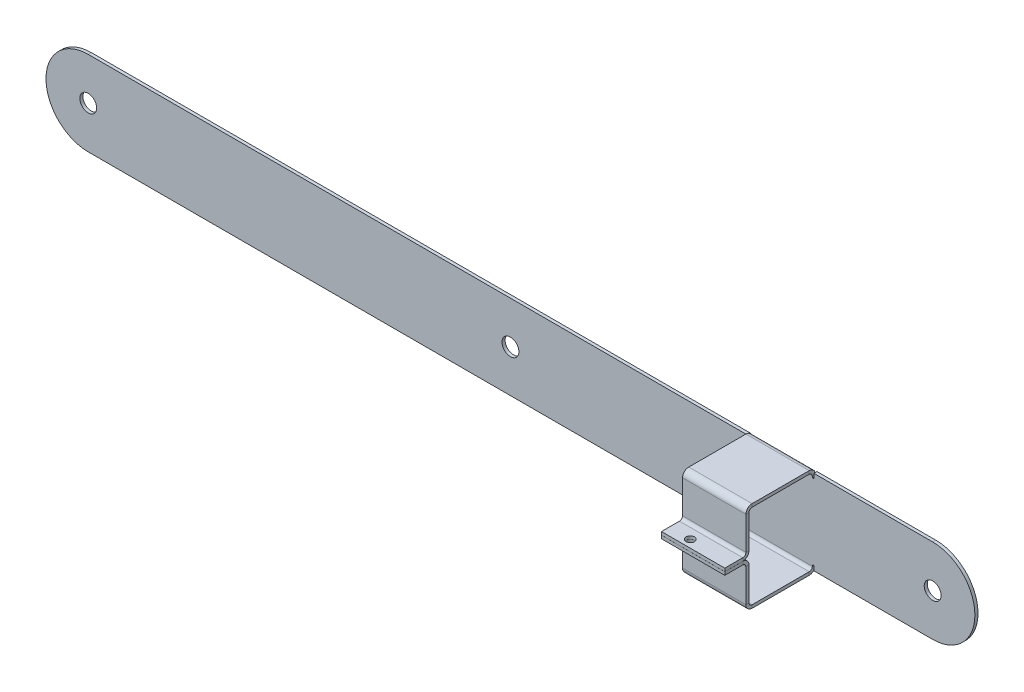
from build123d import *

# Parameters (mm, degrees)
SKETCH2_R                     = 2
BASE_FLANGE1_DEPTH            = 0.7366
EDGE_FLANGE1_STRIP_W          = 4.4196
EDGE_FLANGE1_STRIP_H          = 0.7366
EDGE_FLANGE1_STRIP_CUT_DEPTH  = 15
EDGE_FLANGE1_RELIEF_W         = 4.7879
EDGE_FLANGE1_RELIEF_H         = 0.3683
EDGE_FLANGE1_RELIEF_CUT_DEPTH = 0.7366
EDGE_FLANGE1_DEPTH            = 15
EDGE_FLANGE4_STRIP_W          = 4.4196
EDGE_FLANGE4_STRIP_H          = 0.7366
EDGE_FLANGE4_STRIP_CUT_DEPTH  = 15
EDGE_FLANGE4_RELIEF_W         = 4.7879
EDGE_FLANGE4_RELIEF_H         = 0.3683
EDGE_FLANGE4_RELIEF_CUT_DEPTH = 0.7366
EDGE_FLANGE4_DEPTH            = 15
EDGE_FLANGE5_STRIP_W          = 4.4196
EDGE_FLANGE5_STRIP_H          = 0.7366
EDGE_FLANGE5_STRIP_CUT_DEPTH  = 15
EDGE_FLANGE5_DEPTH            = 15
EDGE_FLANGE6_STRIP_W          = 4.4196
EDGE_FLANGE6_STRIP_H          = 0.7366
EDGE_FLANGE6_STRIP_CUT_DEPTH  = 15
EDGE_FLANGE6_DEPTH            = 15
EDGE_FLANGE7_START            = 56.5
EDGE_FLANGE7_DEPTH            = 15
EDGE_FLANGE7_2_DEPTH          = 15
EDGE_FLANGE8_START            = 56.5
EDGE_FLANGE8_DEPTH            = 15
EDGE_FLANGE8_2_DEPTH          = 15
F_2_0_2_DIAMETER_HOLE4_D      = 2


# Read off the part's stored shape, not the designer's step: Edge-Flange7, Edge-Flange8
# Sheet-metal steps are written as plain solids
with BuildPart() as part:
    # Sketch2 → Base-Flange1 (new body)
    with BuildSketch(Plane.XY):
        with BuildLine():
            Line((-100, 10), (100, 10))
            ThreePointArc((100, 10), (110, 0), (100, -10))
            Line((100, -10), (-100, -10))
            ThreePointArc((-100, -10), (-110, 0), (-100, 10))
        make_face()
        with Locations((100, 0)):
            Circle(SKETCH2_R, mode=Mode.SUBTRACT)
        Circle(SKETCH2_R, mode=Mode.SUBTRACT)
        with Locations((-100, 0)):
            Circle(SKETCH2_R, mode=Mode.SUBTRACT)
    extrude(amount=-BASE_FLANGE1_DEPTH)

    # Edge-Flange1 strip (across the edge) → Edge-Flange1 strip cut (cut)
    with BuildSketch(Plane(origin=(71.5, 10, 0), x_dir=(0, -1, 0), z_dir=(-1, 0, 0))):
        with Locations((-1.4732, -0.3683)):
            Rectangle(EDGE_FLANGE1_STRIP_W, EDGE_FLANGE1_STRIP_H)
    extrude(amount=EDGE_FLANGE1_STRIP_CUT_DEPTH, mode=Mode.SUBTRACT)

    # Edge-Flange1 relief (on the sheet) → Edge-Flange1 relief cut (cut)
    with BuildSketch(Plane(origin=(71.5, 9.2634, 0), x_dir=(0, -1, 0), z_dir=(0, 0, 1))):
        with Locations((-2.02565, 0.18415)):
            Rectangle(EDGE_FLANGE1_RELIEF_W, EDGE_FLANGE1_RELIEF_H)
        with Locations((-2.02565, -15.18415)):
            Rectangle(EDGE_FLANGE1_RELIEF_W, EDGE_FLANGE1_RELIEF_H)
    extrude(amount=-EDGE_FLANGE1_RELIEF_CUT_DEPTH, mode=Mode.SUBTRACT)

    # Edge-Flange1 section (across the edge) → Edge-Flange1 (add)
    with BuildSketch(Plane(origin=(71.5, 10, 0), x_dir=(0, -1, 0), z_dir=(-1, 0, 0))):
        with BuildLine():
            Line((-0.7366, 0.7366), (-0.7366, 15))
            Line((-0.7366, 15), (0, 15))
            Line((0, 15), (0, 0.7366))
            ThreePointArc((0, 0.7366), (0.215745145, 0.215745145), (0.7366, 0))
            Line((0.7366, 0), (0.7366, -0.7366))
            ThreePointArc((0.7366, -0.7366), (-0.30510971, -0.30510971), (-0.7366, 0.7366))
        make_face()
    extrude(amount=EDGE_FLANGE1_DEPTH)

    # Edge-Flange4 strip (across the edge) → Edge-Flange4 strip cut (cut)
    with BuildSketch(Plane(origin=(56.5, -10, 0), x_dir=(0, 1, 0), z_dir=(1, 0, 0))):
        with Locations((-1.4732, -0.3683)):
            Rectangle(EDGE_FLANGE4_STRIP_W, EDGE_FLANGE4_STRIP_H)
    extrude(amount=EDGE_FLANGE4_STRIP_CUT_DEPTH, mode=Mode.SUBTRACT)

    # Edge-Flange4 relief (on the sheet) → Edge-Flange4 relief cut (cut)
    with BuildSketch(Plane(origin=(56.5, -9.2634, 0), x_dir=(0, 1, 0), z_dir=(0, 0, 1))):
        with Locations((-2.02565, 0.18415)):
            Rectangle(EDGE_FLANGE4_RELIEF_W, EDGE_FLANGE4_RELIEF_H)
        with Locations((-2.02565, -15.18415)):
            Rectangle(EDGE_FLANGE4_RELIEF_W, EDGE_FLANGE4_RELIEF_H)
    extrude(amount=-EDGE_FLANGE4_RELIEF_CUT_DEPTH, mode=Mode.SUBTRACT)

    # Edge-Flange4 section (across the edge) → Edge-Flange4 (add)
    with BuildSketch(Plane(origin=(56.5, -10, 0), x_dir=(0, 1, 0), z_dir=(1, 0, 0))):
        with BuildLine():
            Line((-0.7366, 0.7366), (-0.7366, 15))
            Line((-0.7366, 15), (0, 15))
            Line((0, 15), (0, 0.7366))
            ThreePointArc((0, 0.7366), (0.215745145, 0.215745145), (0.7366, 0))
            Line((0.7366, 0), (0.7366, -0.7366))
            ThreePointArc((0.7366, -0.7366), (-0.30510971, -0.30510971), (-0.7366, 0.7366))
        make_face()
    extrude(amount=EDGE_FLANGE4_DEPTH)

    # Edge-Flange5 strip (across the edge) → Edge-Flange5 strip cut (cut)
    with BuildSketch(Plane(origin=(71.5, 10, 15), x_dir=(0, 0, -1), z_dir=(-1, 0, 0))):
        with Locations((-1.4732, -0.3683)):
            Rectangle(EDGE_FLANGE5_STRIP_W, EDGE_FLANGE5_STRIP_H)
    extrude(amount=EDGE_FLANGE5_STRIP_CUT_DEPTH, mode=Mode.SUBTRACT)

    # Edge-Flange5 section (across the edge) → Edge-Flange5 (add)
    with BuildSketch(Plane(origin=(71.5, 10, 15), x_dir=(0, 0, -1), z_dir=(-1, 0, 0))):
        with BuildLine():
            Line((-0.7366, 0.7366), (-0.7366, 9.99))
            Line((-0.7366, 9.99), (0, 9.99))
            Line((0, 9.99), (0, 0.7366))
            ThreePointArc((0, 0.7366), (0.215745145, 0.215745145), (0.7366, 0))
            Line((0.7366, 0), (0.7366, -0.7366))
            ThreePointArc((0.7366, -0.7366), (-0.30510971, -0.30510971), (-0.7366, 0.7366))
        make_face()
    extrude(amount=EDGE_FLANGE5_DEPTH)

    # Edge-Flange6 strip (across the edge) → Edge-Flange6 strip cut (cut)
    with BuildSketch(Plane(origin=(56.5, -10, 15), x_dir=(0, 0, -1), z_dir=(1, 0, 0))):
        with Locations((-1.4732, -0.3683)):
            Rectangle(EDGE_FLANGE6_STRIP_W, EDGE_FLANGE6_STRIP_H)
    extrude(amount=EDGE_FLANGE6_STRIP_CUT_DEPTH, mode=Mode.SUBTRACT)

    # Edge-Flange6 section (across the edge) → Edge-Flange6 (add)
    with BuildSketch(Plane(origin=(56.5, -10, 15), x_dir=(0, 0, -1), z_dir=(1, 0, 0))):
        with BuildLine():
            Line((-0.7366, 0.7366), (-0.7366, 10))
            Line((-0.7366, 10), (0, 10))
            Line((0, 10), (0, 0.7366))
            ThreePointArc((0, 0.7366), (0.215745145, 0.215745145), (0.7366, 0))
            Line((0.7366, 0), (0.7366, -0.7366))
            ThreePointArc((0.7366, -0.7366), (-0.30510971, -0.30510971), (-0.7366, 0.7366))
        make_face()
    extrude(amount=EDGE_FLANGE6_DEPTH)

    # Edge-Flange7 outline → Edge-Flange7 (cut)
    with BuildSketch(Plane.YZ.offset(EDGE_FLANGE7_START)):
        with BuildLine():
            Line((0, 15.7366), (-0.197371375, 15.7366))
            ThreePointArc((-0.197371375, 15.7366), (-0.7366, 15.197371375), (-1.4732, 15))
            Line((-1.4732, 15), (0, 15))
            Line((0, 15), (0, 15.7366))
        make_face()
    extrude(amount=EDGE_FLANGE7_DEPTH, mode=Mode.SUBTRACT)

    # Edge-Flange7 2 outline → Edge-Flange7 2 (add)
    with BuildSketch(Plane.YZ.offset(EDGE_FLANGE7_START)):
        with BuildLine():
            ThreePointArc((-0.197371375, 15.7366), (-0.050198073, 16.091907783), (0, 16.4732))
            Line((0, 16.4732), (0, 20.7366))
            Line((0, 20.7366), (-0.7366, 20.7366))
            Line((-0.7366, 20.7366), (-0.7366, 16.4732))
            ThreePointArc((-0.7366, 16.4732), (-0.952345145, 15.952345145), (-1.4732, 15.7366))
            Line((-1.4732, 15.7366), (-0.197371375, 15.7366))
        make_face()
    extrude(amount=EDGE_FLANGE7_2_DEPTH)

    # Edge-Flange8 outline → Edge-Flange8 (cut)
    with BuildSketch(Plane.YZ.offset(EDGE_FLANGE8_START)):
        with BuildLine():
            ThreePointArc((1.4832, 15), (0.7466, 15.197371375), (0.207371375, 15.7366))
            Line((0.207371375, 15.7366), (0.01, 15.7366))
            Line((0.01, 15.7366), (0.01, 15))
            Line((0.01, 15), (1.4832, 15))
        make_face()
    extrude(amount=EDGE_FLANGE8_DEPTH, mode=Mode.SUBTRACT)

    # Edge-Flange8 2 outline → Edge-Flange8 2 (add)
    with BuildSketch(Plane.YZ.offset(EDGE_FLANGE8_START)):
        with BuildLine():
            Line((0.7466, 20.7366), (0.01, 20.7366))
            Line((0.01, 20.7366), (0.01, 16.4732))
            ThreePointArc((0.01, 16.4732), (0.060198073, 16.091907783), (0.207371375, 15.7366))
            Line((0.207371375, 15.7366), (1.4832, 15.7366))
            ThreePointArc((1.4832, 15.7366), (0.962345145, 15.952345145), (0.7466, 16.4732))
            Line((0.7466, 16.4732), (0.7466, 20.7366))
        make_face()
    extrude(amount=EDGE_FLANGE8_2_DEPTH)

    # Ø2.0 (2) Diameter Hole4 (through all)
    with Locations(Plane(origin=(0, 0.7466, 0), x_dir=(1, 0, 0), z_dir=(0, 1, 0))):
        with Locations((61.5, -18.907246823)):
            Hole(F_2_0_2_DIAMETER_HOLE4_D / 2)


solid = part.part
